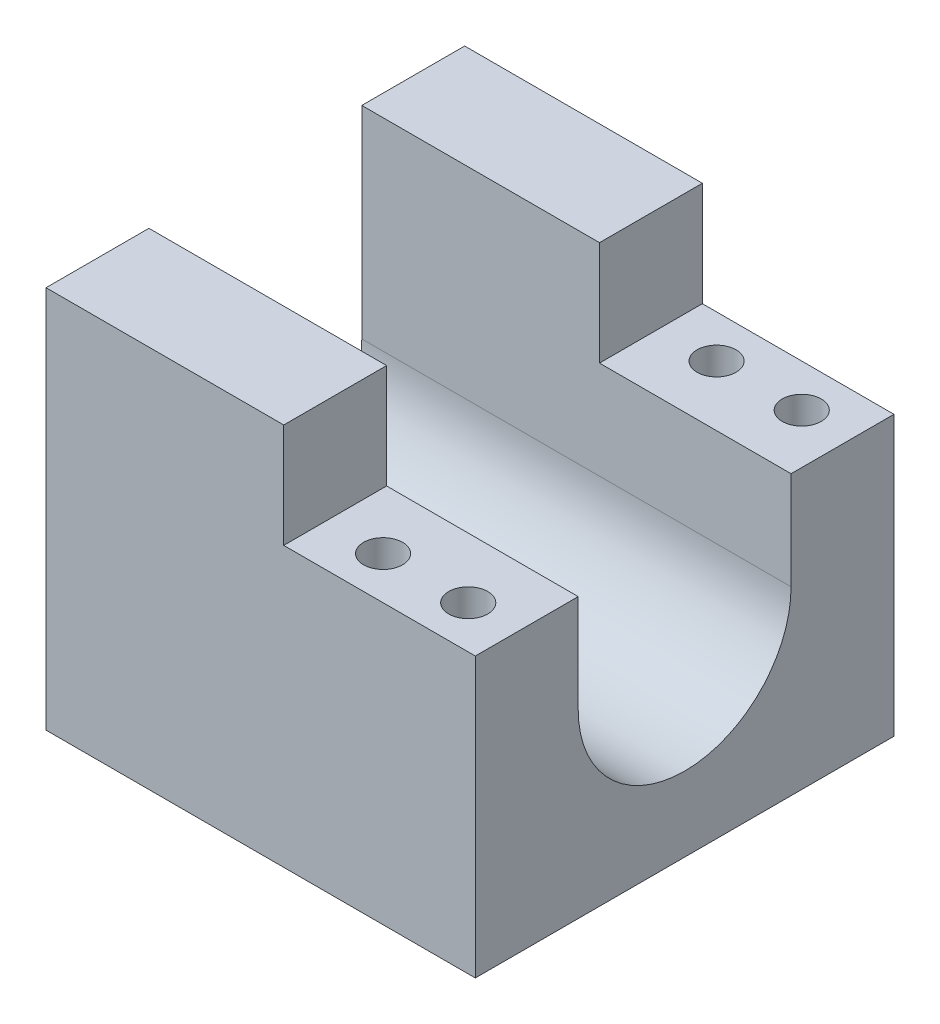
from build123d import *

# Parameters (mm, degrees)
BOSS_EXTRUDE1_DEPTH            = 59
SKETCH2_R                      = 1.65
CUT_EXTRUDE1_DEPTH             = 30
CBORE_FOR_M5_SHCS1_D           = 5.5
CBORE_FOR_M5_SHCS1_DEPTH       = 98.347633298
CBORE_FOR_M5_SHCS1_CBORE_D     = 10
CBORE_FOR_M5_SHCS1_CBORE_DEPTH = 5
CBORE_FOR_M5_SHCS1_TIP         = 1.652366702
CUT_EXTRUDE2_DEPTH             = 107.612616514
CHAMFER1_SIZE                  = 3


with BuildPart() as part:
    # Sketch1 → Boss-Extrude1 (new body)
    with BuildSketch(Plane.XY):
        Polygon((60.5, 22.7), (60.5, 50.3), (58.5, 50.3), (33.5, 50.3), (33.5, 65), (10, 65), (0, 65), (0, 8), (10, 8), (33.5, 8), (60.5, 8), align=None)
    extrude(amount=-BOSS_EXTRUDE1_DEPTH)

    # Sketch2 → Cut-Extrude1 (cut)
    with BuildSketch(Plane.ZY):
        with Locations((-6, 13)):
            Circle(SKETCH2_R)
        with Locations((-6, 60)):
            Circle(SKETCH2_R)
        with Locations((-53, 13)):
            Circle(SKETCH2_R)
        with Locations((-53, 60)):
            Circle(SKETCH2_R)
    extrude(amount=-CUT_EXTRUDE1_DEPTH, mode=Mode.SUBTRACT)

    # CBORE for M5 SHCS1
    with Locations(Plane(origin=(0, 8, 0), x_dir=(-1, 0, 0), z_dir=(0, -1, 0))):
        with Locations((-53.5, 6), (-41.5, 6), (-41.5, 53), (-53.5, 53)):
            CounterBoreHole(CBORE_FOR_M5_SHCS1_D / 2, CBORE_FOR_M5_SHCS1_CBORE_D / 2, CBORE_FOR_M5_SHCS1_CBORE_DEPTH, depth=CBORE_FOR_M5_SHCS1_DEPTH)
            with Locations((0, 0, -(CBORE_FOR_M5_SHCS1_DEPTH + CBORE_FOR_M5_SHCS1_TIP / 2))):  # 118° drill point
                Cone(0, CBORE_FOR_M5_SHCS1_D / 2, CBORE_FOR_M5_SHCS1_TIP, mode=Mode.SUBTRACT)

    # Sketch7 → Cut-Extrude2 (cut, through all)
    with BuildSketch(Plane.ZY):
        with BuildLine():
            Line((-14.5, 36.5), (-14.5, 65))
            Line((-14.5, 65), (-44.5, 65))
            Line((-44.5, 65), (-44.5, 36.5))
            ThreePointArc((-44.5, 36.5), (-29.5, 21.5), (-14.5, 36.5))
        make_face()
    extrude(amount=-CUT_EXTRUDE2_DEPTH, mode=Mode.SUBTRACT)

    # Chamfer1
    # the kernel refuses this chamfer: 3 mm, written as the material it takes off along each edge
    with BuildSketch(Plane(origin=(68.215048964, 8, 0), x_dir=(0, -0.02749587661058649, -0.9996219169112968), z_dir=(-1, 0, 0))) as chamfer1_piece_1:
        Polygon((CHAMFER1_SIZE * 0.999621916911, -CHAMFER1_SIZE * 0.0274958766106), (-CHAMFER1_SIZE * 0.0274958766106, -CHAMFER1_SIZE * 0.999621916911), (0, 0), align=None)
    extrude(amount=75.930097928, mode=Mode.SUBTRACT)
    with BuildSketch(Plane(origin=(60.5, 8, 7.715048964), x_dir=(0.02749587661058678, 0.9996219169112968, 0), z_dir=(0, 0, -1)), Plane(origin=(0, 8, 7.715048964), x_dir=(0.9996219169112968, -0.02749587661058649, 0), z_dir=(0, 0, -1))) as chamfer1_piece_2:
        Polygon((CHAMFER1_SIZE * 0.999621916911, -CHAMFER1_SIZE * 0.0274958766106), (-CHAMFER1_SIZE * 0.0274958766106, -CHAMFER1_SIZE * 0.999621916911), (0, 0), align=None)
    extrude(amount=74.430097928, mode=Mode.SUBTRACT)
    with BuildSketch(Plane(origin=(-7.715048964, 8, -59), x_dir=(0, 0.9996219169112968, -0.02749587661058678), z_dir=(1, 0, 0))) as chamfer1_piece_3:
        Polygon((CHAMFER1_SIZE * 0.999621916911, CHAMFER1_SIZE * 0.0274958766106), (-CHAMFER1_SIZE * 0.0274958766106, CHAMFER1_SIZE * 0.999621916911), (0, 0), align=None)
    extrude(amount=75.930097928, mode=Mode.SUBTRACT)
    with BuildSketch(Plane(origin=(53.5, 8, -53), x_dir=(-1, 0, 0), z_dir=(0, 0, 1))) as chamfer1_piece_4:
        Polygon((5 + CHAMFER1_SIZE, 0), (5, -CHAMFER1_SIZE), (5, 0), align=None)
    revolve(axis=Axis((53.5, 8, -53), (0, -1, 0)), mode=Mode.SUBTRACT)
    with BuildSketch(Plane(origin=(41.5, 8, -53), x_dir=(-1, 0, 0), z_dir=(0, 0, 1))) as chamfer1_piece_5:
        Polygon((5 + CHAMFER1_SIZE, 0), (5, -CHAMFER1_SIZE), (5, 0), align=None)
    revolve(axis=Axis((41.5, 8, -53), (0, -1, 0)), mode=Mode.SUBTRACT)
    with BuildSketch(Plane(origin=(41.5, 8, -6), x_dir=(-1, 0, 0), z_dir=(0, 0, 1))) as chamfer1_piece_6:
        Polygon((5 + CHAMFER1_SIZE, 0), (5, -CHAMFER1_SIZE), (5, 0), align=None)
    revolve(axis=Axis((41.5, 8, -6), (0, -1, 0)), mode=Mode.SUBTRACT)
    with BuildSketch(Plane(origin=(53.5, 8, -6), x_dir=(-1, 0, 0), z_dir=(0, 0, 1))) as chamfer1_piece_7:
        Polygon((5 + CHAMFER1_SIZE, 0), (5, -CHAMFER1_SIZE), (5, 0), align=None)
    revolve(axis=Axis((53.5, 8, -6), (0, -1, 0)), mode=Mode.SUBTRACT)


solid = part.part
